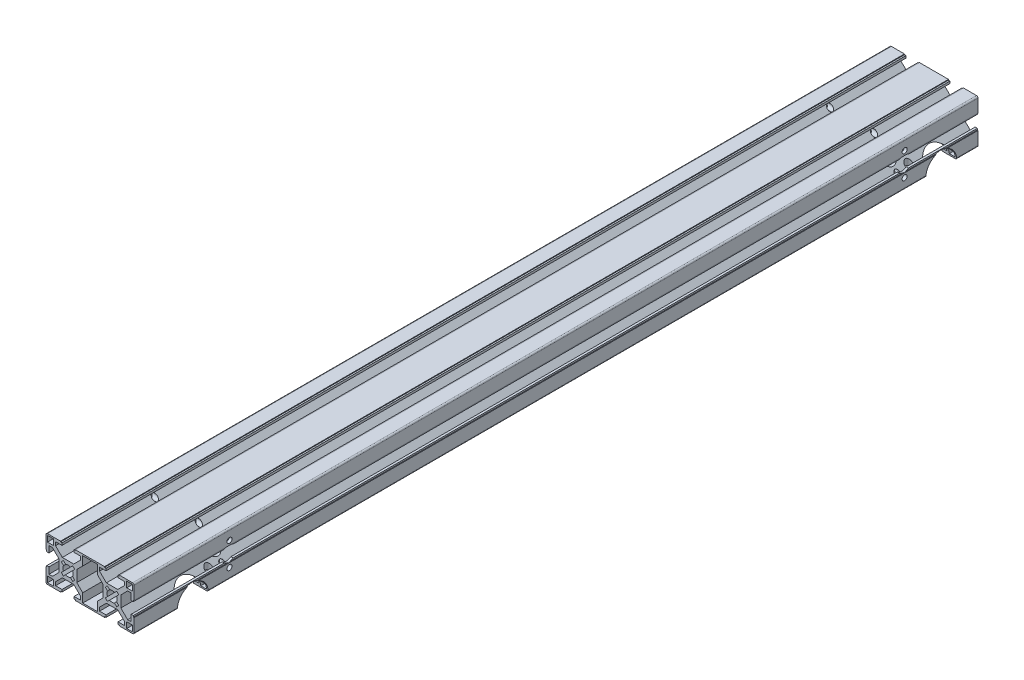
from build123d import *

# Parameters (mm, degrees)
ESBO_O1_W                      = 4
ESBO_O1_H                      = 4
RESSALTO_EXTRUS_O1_DEPTH       = 560
PADR_OCIRCULAR1_COUNT          = 4
PADR_O_LINEAR1_COUNT           = 2
PADR_O_LINEAR1_PITCH           = 30
PADR_O_LINEAR1_COPY_1_SKETCH_W = 4
PADR_O_LINEAR1_COPY_1_SKETCH_H = 4
PADR_O_LINEAR1_COPY_1_DEPTH    = 560
PADR_O_LINEAR1_COPY_2_SKETCH_W = 4
PADR_O_LINEAR1_COPY_2_SKETCH_H = 4
PADR_O_LINEAR1_COPY_2_DEPTH    = 560
PADR_O_LINEAR1_COPY_3_SKETCH_W = 4
PADR_O_LINEAR1_COPY_3_SKETCH_H = 4
PADR_O_LINEAR1_COPY_3_DEPTH    = 560
ESBO_O4_W                      = 10
ESBO_O4_H                      = 28
CORTE_EXTRUS_O1_DEPTH          = 563.005338053
FILETE1_R                      = 1
SKETCH1_R                      = 10.5
CUT_EXTRUDE1_DEPTH             = 563.517555282
SKETCH5_R                      = 4
SKETCH5_R_2                    = 1.75
CUT_EXTRUDE2_DEPTH             = 564.404827923
SKETCH6_R                      = 5.1
CUT_EXTRUDE3_DEPTH             = 10
SKETCH8_R                      = 2.5
CUT_EXTRUDE4_DEPTH             = 15
SKETCH9_W                      = 4
SKETCH9_H                      = 4
BOSS_EXTRUDE1_DEPTH            = 15


with BuildPart() as part:
    # Esboço1 → Ressalto-extrusão1 (new body)
    with BuildSketch(Plane.XY):
        with BuildLine():
            ThreePointArc((-1.664601464, 3.078815026), (-0.858529967, 3.393070335), (0, 3.5))
            Line((0, 3.5), (0, 6))
            Line((0, 6), (-3.878679656, 6))
            Line((-3.878679656, 6), (-8.5, 10.621320344))
            Line((-8.5, 10.621320344), (-8.5, 13))
            Line((-8.5, 13), (-4.1, 13))
            Line((-4.1, 13), (-4.1, 14.5))
            Line((-4.1, 14.5), (-5.1, 14.5))
            Line((-5.1, 14.5), (-5.1, 15))
            Line((-5.1, 15), (-15, 15))
            Line((-15, 15), (-15, 5.1))
            Line((-15, 5.1), (-14.5, 5.1))
            Line((-14.5, 5.1), (-14.5, 4.1))
            Line((-14.5, 4.1), (-13, 4.1))
            Line((-13, 4.1), (-13, 8.5))
            Line((-13, 8.5), (-10.621320344, 8.5))
            Line((-10.621320344, 8.5), (-6, 3.878679656))
            Line((-6, 3.878679656), (-6, 0))
            Line((-6, 0), (-3.5, 0))
            ThreePointArc((-3.5, 0), (-3.393070335, 0.858529967), (-3.078815026, 1.664601464))
            Line((-3.078815026, 1.664601464), (-4.596194078, 3.181980515))
            Line((-4.596194078, 3.181980515), (-3.181980515, 4.596194078))
            Line((-3.181980515, 4.596194078), (-1.664601464, 3.078815026))
        make_face()
        with Locations((-12, 12)):
            Rectangle(ESBO_O1_W, ESBO_O1_H, mode=Mode.SUBTRACT)
    ressalto_extrus_o1 = extrude(amount=RESSALTO_EXTRUS_O1_DEPTH)

    # PadrãoCircular1: Ressalto-extrusão1 ×4 about axis
    padr_ocircular1_axis = Axis((0, 0, 0), (0, 0, 1))
    for i in range(1, PADR_OCIRCULAR1_COUNT):
        add(ressalto_extrus_o1.rotate(padr_ocircular1_axis, i * 360 / PADR_OCIRCULAR1_COUNT))

    # Padrão linear1: Ressalto-extrusão1 ×2
    with Locations(*[(i * PADR_O_LINEAR1_PITCH, 0, 0) for i in range(1, PADR_O_LINEAR1_COUNT)]):
        add(ressalto_extrus_o1)

    # Padrão linear1 copy 1 sketch → Padrão linear1 copy 1 (add)
    with BuildSketch(Plane(origin=(30, 0, 0), x_dir=(0, 1, 0), z_dir=(0, 0, 1))):
        with BuildLine():
            ThreePointArc((-1.664601464, 3.078815026), (-0.858529967, 3.393070335), (0, 3.5))
            Line((0, 3.5), (0, 6))
            Line((0, 6), (-3.878679656, 6))
            Line((-3.878679656, 6), (-8.5, 10.621320344))
            Line((-8.5, 10.621320344), (-8.5, 13))
            Line((-8.5, 13), (-4.1, 13))
            Line((-4.1, 13), (-4.1, 14.5))
            Line((-4.1, 14.5), (-5.1, 14.5))
            Line((-5.1, 14.5), (-5.1, 15))
            Line((-5.1, 15), (-15, 15))
            Line((-15, 15), (-15, 5.1))
            Line((-15, 5.1), (-14.5, 5.1))
            Line((-14.5, 5.1), (-14.5, 4.1))
            Line((-14.5, 4.1), (-13, 4.1))
            Line((-13, 4.1), (-13, 8.5))
            Line((-13, 8.5), (-10.621320344, 8.5))
            Line((-10.621320344, 8.5), (-6, 3.878679656))
            Line((-6, 3.878679656), (-6, 0))
            Line((-6, 0), (-3.5, 0))
            ThreePointArc((-3.5, 0), (-3.393070335, 0.858529967), (-3.078815026, 1.664601464))
            Line((-3.078815026, 1.664601464), (-4.596194078, 3.181980515))
            Line((-4.596194078, 3.181980515), (-3.181980515, 4.596194078))
            Line((-3.181980515, 4.596194078), (-1.664601464, 3.078815026))
        make_face()
        with Locations((-12, 12)):
            Rectangle(PADR_O_LINEAR1_COPY_1_SKETCH_W, PADR_O_LINEAR1_COPY_1_SKETCH_H, mode=Mode.SUBTRACT)
    extrude(amount=PADR_O_LINEAR1_COPY_1_DEPTH)

    # Padrão linear1 copy 2 sketch → Padrão linear1 copy 2 (add)
    with BuildSketch(Plane(origin=(30, 0, 0), x_dir=(-1, 0, 0), z_dir=(0, 0, 1))):
        with BuildLine():
            ThreePointArc((-1.664601464, 3.078815026), (-0.858529967, 3.393070335), (0, 3.5))
            Line((0, 3.5), (0, 6))
            Line((0, 6), (-3.878679656, 6))
            Line((-3.878679656, 6), (-8.5, 10.621320344))
            Line((-8.5, 10.621320344), (-8.5, 13))
            Line((-8.5, 13), (-4.1, 13))
            Line((-4.1, 13), (-4.1, 14.5))
            Line((-4.1, 14.5), (-5.1, 14.5))
            Line((-5.1, 14.5), (-5.1, 15))
            Line((-5.1, 15), (-15, 15))
            Line((-15, 15), (-15, 5.1))
            Line((-15, 5.1), (-14.5, 5.1))
            Line((-14.5, 5.1), (-14.5, 4.1))
            Line((-14.5, 4.1), (-13, 4.1))
            Line((-13, 4.1), (-13, 8.5))
            Line((-13, 8.5), (-10.621320344, 8.5))
            Line((-10.621320344, 8.5), (-6, 3.878679656))
            Line((-6, 3.878679656), (-6, 0))
            Line((-6, 0), (-3.5, 0))
            ThreePointArc((-3.5, 0), (-3.393070335, 0.858529967), (-3.078815026, 1.664601464))
            Line((-3.078815026, 1.664601464), (-4.596194078, 3.181980515))
            Line((-4.596194078, 3.181980515), (-3.181980515, 4.596194078))
            Line((-3.181980515, 4.596194078), (-1.664601464, 3.078815026))
        make_face()
        with Locations((-12, 12)):
            Rectangle(PADR_O_LINEAR1_COPY_2_SKETCH_W, PADR_O_LINEAR1_COPY_2_SKETCH_H, mode=Mode.SUBTRACT)
    extrude(amount=PADR_O_LINEAR1_COPY_2_DEPTH)

    # Padrão linear1 copy 3 sketch → Padrão linear1 copy 3 (add)
    with BuildSketch(Plane(origin=(30, 0, 0), x_dir=(0, -1, 0), z_dir=(0, 0, 1))):
        with BuildLine():
            ThreePointArc((-1.664601464, 3.078815026), (-0.858529967, 3.393070335), (0, 3.5))
            Line((0, 3.5), (0, 6))
            Line((0, 6), (-3.878679656, 6))
            Line((-3.878679656, 6), (-8.5, 10.621320344))
            Line((-8.5, 10.621320344), (-8.5, 13))
            Line((-8.5, 13), (-4.1, 13))
            Line((-4.1, 13), (-4.1, 14.5))
            Line((-4.1, 14.5), (-5.1, 14.5))
            Line((-5.1, 14.5), (-5.1, 15))
            Line((-5.1, 15), (-15, 15))
            Line((-15, 15), (-15, 5.1))
            Line((-15, 5.1), (-14.5, 5.1))
            Line((-14.5, 5.1), (-14.5, 4.1))
            Line((-14.5, 4.1), (-13, 4.1))
            Line((-13, 4.1), (-13, 8.5))
            Line((-13, 8.5), (-10.621320344, 8.5))
            Line((-10.621320344, 8.5), (-6, 3.878679656))
            Line((-6, 3.878679656), (-6, 0))
            Line((-6, 0), (-3.5, 0))
            ThreePointArc((-3.5, 0), (-3.393070335, 0.858529967), (-3.078815026, 1.664601464))
            Line((-3.078815026, 1.664601464), (-4.596194078, 3.181980515))
            Line((-4.596194078, 3.181980515), (-3.181980515, 4.596194078))
            Line((-3.181980515, 4.596194078), (-1.664601464, 3.078815026))
        make_face()
        with Locations((-12, 12)):
            Rectangle(PADR_O_LINEAR1_COPY_3_SKETCH_W, PADR_O_LINEAR1_COPY_3_SKETCH_H, mode=Mode.SUBTRACT)
    extrude(amount=PADR_O_LINEAR1_COPY_3_DEPTH)

    # Esboço4 → Corte-extrusão1 (cut, through all)
    with BuildSketch(Plane(origin=(0, 0, 0), x_dir=(-1, 0, 0), z_dir=(0, 0, -1))):
        with Locations((-15, 0)):
            Rectangle(ESBO_O4_W, ESBO_O4_H)
    extrude(amount=-CORTE_EXTRUS_O1_DEPTH, mode=Mode.SUBTRACT)

    # Filete1
    filete1_edges = [part.edges().sort_by_distance(p)[0] for p in [
        (45, -15, 280),
        (45, 15, 280),
        (-15, 15, 280),
        (-15, -15, 280),
    ]]
    fillet(filete1_edges, radius=FILETE1_R)

    # Sketch1 → Cut-Extrude1 (cut, symmetric)
    with BuildSketch(Plane.ZY.offset(6)):
        with Locations((25, -15)):
            Circle(SKETCH1_R)
    cut_extrude1 = extrude(amount=CUT_EXTRUDE1_DEPTH, both=True, mode=Mode.SUBTRACT)

    # Mirror1: Cut-Extrude1 across plane
    add(cut_extrude1.mirror(Plane.XY.offset(280)), mode=Mode.SUBTRACT)

    # Sketch5 → Cut-Extrude2 (cut, through all)
    with BuildSketch(Plane.ZY.offset(15)):
        with Locations(Location((50, 0, 0), (0, 0, 255.852546084))):
            Circle(SKETCH5_R)
        with Locations(Location((50, -8, 0), (0, 0, 270))):
            Circle(SKETCH5_R_2)
        with Locations(Location((42, 0, 0), (0, 0, 252.026778114))):
            Circle(SKETCH5_R_2)
        with Locations(Location((50, 8, 0), (0, 0, 270))):
            Circle(SKETCH5_R_2)
        with Locations(Location((58, 0, 0), (0, 0, 252.026778114))):
            Circle(SKETCH5_R_2)
        with Locations(Location((502, 0, 0), (0, 0, 252.026778114))):
            Circle(SKETCH5_R_2)
        with Locations(Location((510, 8, 0), (0, 0, 270))):
            Circle(SKETCH5_R_2)
        with Locations(Location((518, 0, 0), (0, 0, 252.026778114))):
            Circle(SKETCH5_R_2)
        with Locations(Location((510, -8, 0), (0, 0, 90))):
            Circle(SKETCH5_R_2)
        with Locations(Location((510, 0, 0), (0, 0, 284.147453916))):
            Circle(SKETCH5_R)
    extrude(amount=-CUT_EXTRUDE2_DEPTH, mode=Mode.SUBTRACT)

    # Sketch6 → Cut-Extrude3 (cut)
    with BuildSketch(Plane.ZY.offset(15)):
        with Locations(Location((50, 0, 0), (0, 0, 270))):
            Circle(SKETCH6_R)
        with Locations(Location((510, 0, 0), (0, 0, 229.510539923))):
            Circle(SKETCH6_R)
    cut_extrude3 = extrude(amount=-CUT_EXTRUDE3_DEPTH, mode=Mode.SUBTRACT)

    # Mirror2: Cut-Extrude3 across plane
    add(cut_extrude3.mirror(Plane.ZY.offset(-15)), mode=Mode.SUBTRACT)

    # Sketch8 → Cut-Extrude4 (cut)
    with BuildSketch(Plane.XZ.offset(15)):
        with Locations(Location((-9.55, 518.5, 0), (0, 0, 270))):
            Circle(SKETCH8_R)
        with Locations(Location((9.55, 518.5, 0), (0, 0, 270))):
            Circle(SKETCH8_R)
        with Locations(Location((20.45, 518.5, 0), (0, 0, 270))):
            Circle(SKETCH8_R)
        with Locations(Location((39.55, 518.5, 0), (0, 0, 270))):
            Circle(SKETCH8_R)
        with Locations(Location((-9.55, 41.5, 0), (0, 0, 244.625811743))):
            Circle(SKETCH8_R)
        with Locations(Location((9.55, 41.5, 0), (0, 0, 280.369759805))):
            Circle(SKETCH8_R)
        with Locations(Location((20.45, 41.5, 0), (0, 0, 259.630240195))):
            Circle(SKETCH8_R)
        with Locations(Location((39.55, 41.5, 0), (0, 0, 295.374188257))):
            Circle(SKETCH8_R)
    extrude(amount=-CUT_EXTRUDE4_DEPTH, mode=Mode.SUBTRACT)

    # Sketch9 → Boss-Extrude1 (add)
    with BuildSketch(Plane.XY.offset(560)):
        with BuildLine():
            Line((44, 15), (35.1, 15))
            Line((35.1, 15), (35.1, 14.5))
            Line((35.1, 14.5), (34.1, 14.5))
            Line((34.1, 14.5), (34.1, 13))
            Line((34.1, 13), (38.5, 13))
            Line((38.5, 13), (38.5, 10.621320344))
            Line((38.5, 10.621320344), (33.878679656, 6))
            Line((33.878679656, 6), (26.121320344, 6))
            Line((26.121320344, 6), (21.5, 10.621320344))
            Line((21.5, 10.621320344), (21.5, 13))
            Line((21.5, 13), (25.9, 13))
            Line((25.9, 13), (25.9, 14.5))
            Line((25.9, 14.5), (24.9, 14.5))
            Line((24.9, 14.5), (24.9, 15))
            Line((24.9, 15), (5.1, 15))
            Line((5.1, 15), (5.1, 14.5))
            Line((5.1, 14.5), (4.1, 14.5))
            Line((4.1, 14.5), (4.1, 13))
            Line((4.1, 13), (8.5, 13))
            Line((8.5, 13), (8.5, 10.621320344))
            Line((8.5, 10.621320344), (3.878679656, 6))
            Line((3.878679656, 6), (-3.878679656, 6))
            Line((-3.878679656, 6), (-8.5, 10.621320344))
            Line((-8.5, 10.621320344), (-8.5, 13))
            Line((-8.5, 13), (-4.1, 13))
            Line((-4.1, 13), (-4.1, 14.5))
            Line((-4.1, 14.5), (-5.1, 14.5))
            Line((-5.1, 14.5), (-5.1, 15))
            Line((-5.1, 15), (-14, 15))
            ThreePointArc((-14, 15), (-14.707106781, 14.707106781), (-15, 14))
            Line((-15, 14), (-15, 5.1))
            Line((-15, 5.1), (-14.5, 5.1))
            Line((-14.5, 5.1), (-14.5, 4.1))
            Line((-14.5, 4.1), (-13, 4.1))
            Line((-13, 4.1), (-13, 8.5))
            Line((-13, 8.5), (-10.621320344, 8.5))
            Line((-10.621320344, 8.5), (-6, 3.878679656))
            Line((-6, 3.878679656), (-6, -3.878679656))
            Line((-6, -3.878679656), (-10.621320344, -8.5))
            Line((-10.621320344, -8.5), (-13, -8.5))
            Line((-13, -8.5), (-13, -4.1))
            Line((-13, -4.1), (-14.5, -4.1))
            Line((-14.5, -4.1), (-14.5, -5.1))
            Line((-14.5, -5.1), (-15, -5.1))
            Line((-15, -5.1), (-15, -14))
            ThreePointArc((-15, -14), (-14.707106781, -14.707106781), (-14, -15))
            Line((-14, -15), (-5.1, -15))
            Line((-5.1, -15), (-5.1, -14.5))
            Line((-5.1, -14.5), (-4.1, -14.5))
            Line((-4.1, -14.5), (-4.1, -13))
            Line((-4.1, -13), (-8.5, -13))
            Line((-8.5, -13), (-8.5, -10.621320344))
            Line((-8.5, -10.621320344), (-3.878679656, -6))
            Line((-3.878679656, -6), (3.878679656, -6))
            Line((3.878679656, -6), (8.5, -10.621320344))
            Line((8.5, -10.621320344), (8.5, -13))
            Line((8.5, -13), (4.1, -13))
            Line((4.1, -13), (4.1, -14.5))
            Line((4.1, -14.5), (5.1, -14.5))
            Line((5.1, -14.5), (5.1, -15))
            Line((5.1, -15), (24.9, -15))
            Line((24.9, -15), (24.9, -14.5))
            Line((24.9, -14.5), (25.9, -14.5))
            Line((25.9, -14.5), (25.9, -13))
            Line((25.9, -13), (21.5, -13))
            Line((21.5, -13), (21.5, -10.621320344))
            Line((21.5, -10.621320344), (26.121320344, -6))
            Line((26.121320344, -6), (33.878679656, -6))
            Line((33.878679656, -6), (38.5, -10.621320344))
            Line((38.5, -10.621320344), (38.5, -13))
            Line((38.5, -13), (34.1, -13))
            Line((34.1, -13), (34.1, -14.5))
            Line((34.1, -14.5), (35.1, -14.5))
            Line((35.1, -14.5), (35.1, -15))
            Line((35.1, -15), (44, -15))
            ThreePointArc((44, -15), (44.707106781, -14.707106781), (45, -14))
            Line((45, -14), (45, -5.1))
            Line((45, -5.1), (44.5, -5.1))
            Line((44.5, -5.1), (44.5, -4.1))
            Line((44.5, -4.1), (43, -4.1))
            Line((43, -4.1), (43, -8.5))
            Line((43, -8.5), (40.621320344, -8.5))
            Line((40.621320344, -8.5), (36, -3.878679656))
            Line((36, -3.878679656), (36, 3.878679656))
            Line((36, 3.878679656), (40.621320344, 8.5))
            Line((40.621320344, 8.5), (43, 8.5))
            Line((43, 8.5), (43, 4.1))
            Line((43, 4.1), (44.5, 4.1))
            Line((44.5, 4.1), (44.5, 5.1))
            Line((44.5, 5.1), (45, 5.1))
            Line((45, 5.1), (45, 14))
            ThreePointArc((45, 14), (44.707106781, 14.707106781), (44, 15))
        make_face()
        with BuildLine():
            ThreePointArc((33.078815026, 1.664601464), (33.5, 0), (33.078815026, -1.664601464))
            Line((33.078815026, -1.664601464), (34.596194078, -3.181980515))
            Line((34.596194078, -3.181980515), (33.181980515, -4.596194078))
            Line((33.181980515, -4.596194078), (31.664601464, -3.078815026))
            ThreePointArc((31.664601464, -3.078815026), (30, -3.5), (28.335398536, -3.078815026))
            Line((28.335398536, -3.078815026), (26.818019485, -4.596194078))
            Line((26.818019485, -4.596194078), (25.403805922, -3.181980515))
            Line((25.403805922, -3.181980515), (26.921184974, -1.664601464))
            ThreePointArc((26.921184974, -1.664601464), (26.5, 0), (26.921184974, 1.664601464))
            Line((26.921184974, 1.664601464), (25.403805922, 3.181980515))
            Line((25.403805922, 3.181980515), (26.818019485, 4.596194078))
            Line((26.818019485, 4.596194078), (28.335398536, 3.078815026))
            ThreePointArc((28.335398536, 3.078815026), (30, 3.5), (31.664601464, 3.078815026))
            Line((31.664601464, 3.078815026), (33.181980515, 4.596194078))
            Line((33.181980515, 4.596194078), (34.596194078, 3.181980515))
            Line((34.596194078, 3.181980515), (33.078815026, 1.664601464))
        make_face(mode=Mode.SUBTRACT)
        Polygon((24, 3.878679656), (24, -3.878679656), (20, -7.878679656), (20, -14), (10, -14), (10, -7.878679656), (6, -3.878679656), (6, 3.878679656), (10, 7.878679656), (10, 14), (20, 14), (20, 7.878679656), align=None, mode=Mode.SUBTRACT)
        with BuildLine():
            ThreePointArc((3.078815026, 1.664601464), (3.5, 0), (3.078815026, -1.664601464))
            Line((3.078815026, -1.664601464), (4.596194078, -3.181980515))
            Line((4.596194078, -3.181980515), (3.181980515, -4.596194078))
            Line((3.181980515, -4.596194078), (1.664601464, -3.078815026))
            ThreePointArc((1.664601464, -3.078815026), (-0.000381607, -3.499999979), (-1.665272795, -3.078451968))
            Line((-1.665272795, -3.078451968), (-3.181980515, -4.596194078))
            Line((-3.181980515, -4.596194078), (-4.596194078, -3.181980515))
            Line((-4.596194078, -3.181980515), (-3.078815026, -1.664601464))
            ThreePointArc((-3.078815026, -1.664601464), (-3.5, 0), (-3.078815026, 1.664601464))
            Line((-3.078815026, 1.664601464), (-4.596194078, 3.181980515))
            Line((-4.596194078, 3.181980515), (-3.181980515, 4.596194078))
            Line((-3.181980515, 4.596194078), (-1.664601464, 3.078815026))
            ThreePointArc((-1.664601464, 3.078815026), (0, 3.5), (1.664601464, 3.078815026))
            Line((1.664601464, 3.078815026), (3.181980515, 4.596194078))
            Line((3.181980515, 4.596194078), (4.596194078, 3.181980515))
            Line((4.596194078, 3.181980515), (3.078815026, 1.664601464))
        make_face(mode=Mode.SUBTRACT)
        with Locations((-12, 12)):
            Rectangle(SKETCH9_W, SKETCH9_H, mode=Mode.SUBTRACT)
        with Locations((42, 12)):
            Rectangle(SKETCH9_W, SKETCH9_H, mode=Mode.SUBTRACT)
        with Locations((42, -12)):
            Rectangle(SKETCH9_W, SKETCH9_H, mode=Mode.SUBTRACT)
        with Locations((-12, -12)):
            Rectangle(SKETCH9_W, SKETCH9_H, mode=Mode.SUBTRACT)
    extrude(amount=BOSS_EXTRUDE1_DEPTH)


solid = part.part
